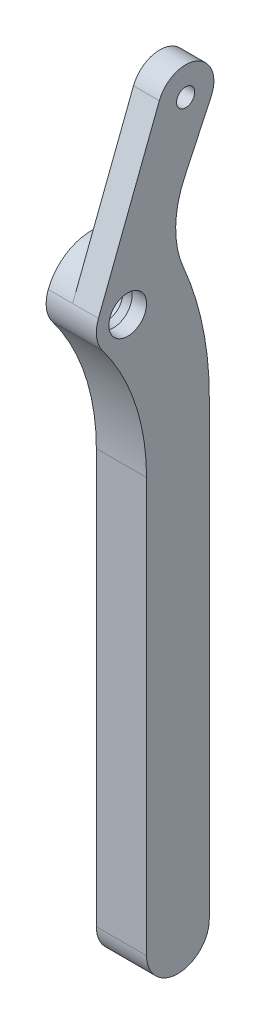
from build123d import *

# Parameters (mm, degrees)
SKETCH1_R           = 2.5
SKETCH1_R_2         = 1.45
BOSS_EXTRUDE1_DEPTH = 4
SKETCH2_R           = 3
CUT_EXTRUDE1_DEPTH  = 3.3
CUT_EXTRUDE2_START  = -0.12
SKETCH1_5_R         = 4.5
SKETCH1_5_R_2       = 1.45
CUT_EXTRUDE2_DEPTH  = 96.951003405
CUT_EXTRUDE3_START  = -5.7
SKETCH2_2_R         = 3
CUT_EXTRUDE3_DEPTH  = 2.3
CHAMFER1_SIZE2      = 0.5
CHAMFER1_SIZE       = 1


with BuildPart() as part:
    # Sketch1 → Boss-Extrude1 (new, symmetric)
    with BuildSketch(Plane(origin=(0, 0, 0), x_dir=(0, 0, -1), z_dir=(1, 0, 0))):
        with BuildLine():
            Line((3, -24), (3, -90))
            ThreePointArc((3, -90), (8, -95), (13, -90))
            Line((13, -90), (13, -17.799320055))
            ThreePointArc((13, -17.799320055), (11.959160872, -7.650400571), (8.879977332, 2.075983213))
            ThreePointArc((8.879977332, 2.075983213), (7.645623758, 8.261271435), (9.063072492, 14.407185379))
            Line((9.063072492, 14.407185379), (13.308813282, 23.461117406))
            ThreePointArc((13.308813282, 23.461117406), (10.999511856, 29.511131641), (5.035153889, 26.988835198))
            Line((5.035153889, 26.988835198), (-4.665988868, 1.79681604))
            ThreePointArc((-4.665988868, 1.79681604), (-4.952494502, -0.687603231), (-4, -3))
            ThreePointArc((-4, -3), (1.203915432, -12.932028189), (3, -24))
        make_face()
        Circle(SKETCH1_R, mode=Mode.SUBTRACT)
        with Locations((9.23454387, 25.371700761)):
            Circle(SKETCH1_R_2, mode=Mode.SUBTRACT)
    extrude(amount=BOSS_EXTRUDE1_DEPTH, both=True)

    # Sketch2 → Cut-Extrude1 (cut)
    with BuildSketch(Plane(origin=(4, 0, 0), x_dir=(0, 0, -1), z_dir=(1, 0, 0))):
        Circle(SKETCH2_R)
    extrude(amount=-CUT_EXTRUDE1_DEPTH, mode=Mode.SUBTRACT)

    # Sketch1<5> → Cut-Extrude2 (cut, through all)
    # profile 1 of 2: a face of its own
    with BuildSketch(Plane(origin=(0, 0, 0), x_dir=(0, 0, -1), z_dir=(1, 0, 0)).offset(CUT_EXTRUDE2_START)):
        with BuildLine():
            ThreePointArc((-4.665988868, 1.79681604), (2.013271717, 6.484076223), (8.879977332, 2.075983213))
            ThreePointArc((8.879977332, 2.075983213), (7.645623758, 8.261271435), (9.063072492, 14.407185379))
            Line((9.063072492, 14.407185379), (13.308813282, 23.461117406))
            ThreePointArc((13.308813282, 23.461117406), (7.469575883, 21.232269882), (5.035153889, 26.988835198))
            Line((5.035153889, 26.988835198), (-4.665988868, 1.79681604))
        make_face()
    # profile 2 of 2: a face of its own
    with BuildSketch(Plane(origin=(0, 0, 0), x_dir=(0, 0, -1), z_dir=(1, 0, 0)).offset(CUT_EXTRUDE2_START)):
        with Locations((9.23454387, 25.371700761)):
            Circle(SKETCH1_5_R)
        with Locations((9.23454387, 25.371700761)):
            Circle(SKETCH1_5_R_2, mode=Mode.SUBTRACT)
    extrude(amount=-CUT_EXTRUDE2_DEPTH, mode=Mode.SUBTRACT)

    # Sketch2<2> → Cut-Extrude3 (cut)
    with BuildSketch(Plane(origin=(4, 0, 0), x_dir=(0, 0, -1), z_dir=(1, 0, 0)).offset(CUT_EXTRUDE3_START)):
        Circle(SKETCH2_2_R)
    extrude(amount=-CUT_EXTRUDE3_DEPTH, mode=Mode.SUBTRACT)

    # Chamfer1
    chamfer1_edges = [part.edges().sort_by_distance(p)[0] for p in [
        (0.7, 0, 3),
    ]]
    chamfer1_side = [part.faces().sort_by_distance(p)[0] for p in [
        (0.71, 0, 3),
    ]]
    chamfer(chamfer1_edges, length=CHAMFER1_SIZE - 0.0001, length2=CHAMFER1_SIZE2 - 0.0001, reference=chamfer1_side[0])  # a hair under: the kernel refuses the full size


solid = part.part
